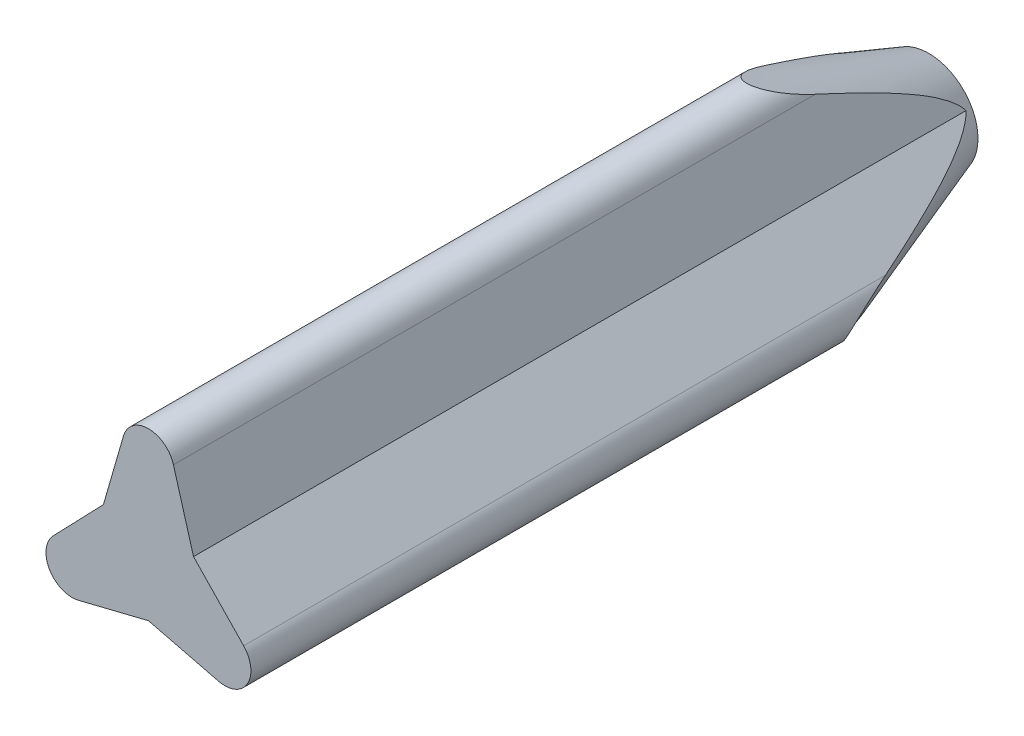
from build123d import *

# Parameters (mm, degrees)
BOSS_EXTRUDE1_DEPTH = 60
FILLET1_R           = 2


with BuildPart() as part:
    # Sketch1 → Boss-Extrude1 (new body)
    with BuildSketch(Plane.XY):
        Polygon((-3.464101615, 2), (-12.124355653, -7), (0, -4), (12.124355653, -7), (3.464101615, 2), (0, 14), align=None)
    extrude(amount=BOSS_EXTRUDE1_DEPTH)

    # Fillet1
    fillet1_edges = [part.edges().sort_by_distance(p)[0] for p in [
        (12.124355653, -7, 30),
        (-12.124355653, -7, 30),
        (0, 14, 30),
    ]]
    fillet(fillet1_edges, radius=FILLET1_R)

    # Sketch2 → Cut-Revolve1 (revolve, cut)
    with BuildSketch(Plane(origin=(0, 0, 0), x_dir=(0, 0, -1), z_dir=(1, 0, 0))):
        Polygon((-14, 8.788897449), (0, 3.788897449), (0, 8.788897449), align=None)
    revolve(axis=Axis((0, 0, 0), (0, 0, -1)), mode=Mode.SUBTRACT)


solid = part.part
